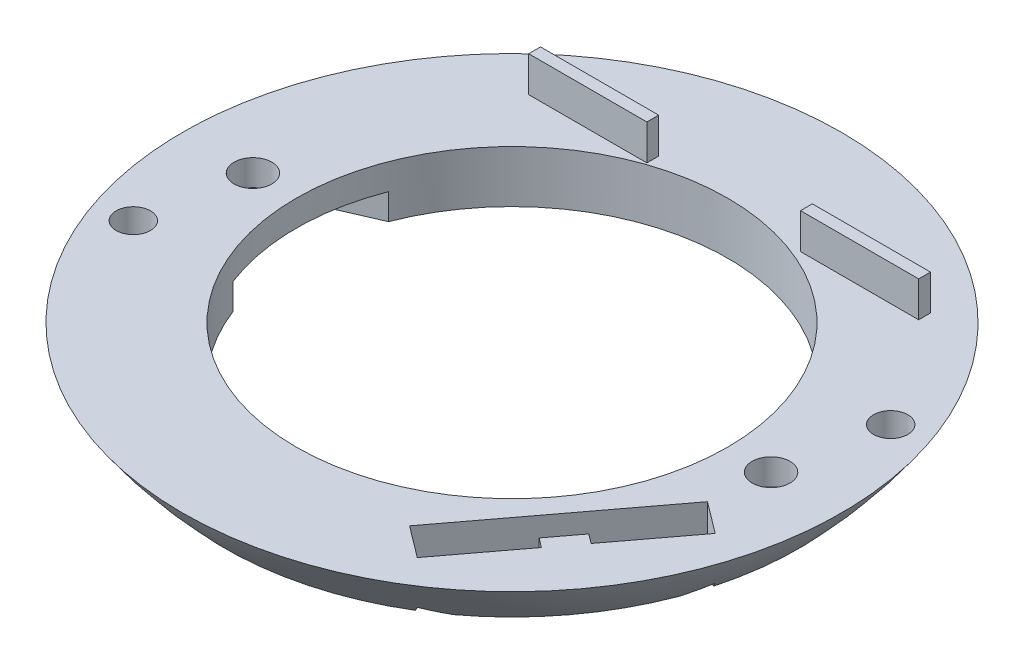
from build123d import *

# Parameters (mm, degrees)
SKETCH2_R                = 33.8
CUT_EXTRUDE1_DEPTH       = 19.1
CUT_EXTRUDE2_START       = -33.8
CUT_EXTRUDE2_DEPTH       = 14.7
BOSS_EXTRUDE2_START      = -2.2
BOSS_EXTRUDE2_DEPTH      = 2.2
CUT_EXTRUDE3_REACH       = 42.08
SKETCH6_R                = 1.6
SKETCH19_R               = 9
CUT_EXTRUDE10_DEPTH      = 1.4
CUT_EXTRUDE11_REACH      = 42.429
CUT_EXTRUDE11_END_RADIUS = 33.8
SKETCH20_R               = 3.5
CUT_EXTRUDE9_REACH       = 44.024
CUT_EXTRUDE9_END_RADIUS  = 33.8
CUT_EXTRUDE7_REACH       = 44.024
CUT_EXTRUDE7_END_RADIUS  = 33.8
SKETCH10_R               = 1.45
SKETCH14_W               = 10
SKETCH14_H               = 1
BOSS_EXTRUDE1_DEPTH      = 3
CUT_EXTRUDE12_START      = -10.118299
SKETCH21_R               = 27.886018002
CUT_EXTRUDE12_DEPTH      = 10.118299


with BuildPart() as part:
    # Sketch1 → Revolve1 (revolve)
    with BuildSketch(Plane.XY, mode=Mode.PRIVATE) as revolve1_sk:
        with BuildLine():
            Line((0, -33.8), (0, 0))
            Line((0, 0), (33.8, 0))
            ThreePointArc((33.8, 0), (23.900209204, -23.900209204), (0, -33.8))
        make_face()
    revolve(revolve1_sk.sketch.rotate(Axis((0, -33.8, 0), (0, 1, 0)), 180), axis=Axis((0, -33.8, 0), (0, 1, 0)))

    # Sketch2 → Cut-Extrude1 (cut)
    with BuildSketch(Plane(origin=(0, 0, 0), x_dir=(1, 0, 0), z_dir=(0, 1, 0))):
        Circle(SKETCH2_R)
    extrude(amount=-CUT_EXTRUDE1_DEPTH, mode=Mode.SUBTRACT)

    # Sketch5 → Cut-Extrude2 (cut)
    with BuildSketch(Plane(origin=(0, 0, 0), x_dir=(1, 0, 0), z_dir=(0, 1, 0)).offset(CUT_EXTRUDE2_START)):
        with BuildLine():
            Line((-17.025732229, 6.571677263), (-23.544283672, 3.742739979))
            ThreePointArc((-23.544283672, 3.742739979), (-23.775794442, 3.633514413), (-24, 3.509985755))
            Line((-24, 3.509985755), (-24, -3.509985755))
            ThreePointArc((-24, -3.509985755), (-23.775794442, -3.633514413), (-23.544283672, -3.742739979))
            Line((-23.544283672, -3.742739979), (-17.025732229, -6.571677263))
            ThreePointArc((-17.025732229, -6.571677263), (0, -18.25), (17.025732229, -6.571677263))
            Line((17.025732229, -6.571677263), (23.544283672, -3.742739979))
            ThreePointArc((23.544283672, -3.742739979), (23.775794442, -3.633514413), (24, -3.509985755))
            Line((24, -3.509985755), (24, 3.509985755))
            ThreePointArc((24, 3.509985755), (23.775794442, 3.633514413), (23.544283672, 3.742739979))
            Line((23.544283672, 3.742739979), (17.025732229, 6.571677263))
            ThreePointArc((17.025732229, 6.571677263), (0, 18.25), (-17.025732229, 6.571677263))
        make_face()
    extrude(amount=CUT_EXTRUDE2_DEPTH, mode=Mode.SUBTRACT)

    # Sketch16 → Boss-Extrude2 (add)
    with BuildSketch(Plane(origin=(0, -19.1, 0), x_dir=(1, 0, 0), z_dir=(0, 1, 0)).offset(BOSS_EXTRUDE2_START)):
        with BuildLine():
            Line((17.025732229, 6.571677263), (23.544283672, 3.742739979))
            ThreePointArc((23.544283672, 3.742739979), (23.775794442, 3.633514413), (24, 3.509985755))
            Line((24, 3.509985755), (24, -3.509985755))
            ThreePointArc((24, -3.509985755), (23.775794442, -3.633514413), (23.544283672, -3.742739979))
            Line((23.544283672, -3.742739979), (17.025732229, -6.571677263))
            ThreePointArc((17.025732229, -6.571677263), (18.25, 0), (17.025732229, 6.571677263))
        make_face()
        with BuildLine():
            Line((-23.544283672, -3.742739979), (-17.025732229, -6.571677263))
            ThreePointArc((-17.025732229, -6.571677263), (-18.25, 0), (-17.025732229, 6.571677263))
            Line((-17.025732229, 6.571677263), (-23.544283672, 3.742739979))
            ThreePointArc((-23.544283672, 3.742739979), (-23.775794442, 3.633514413), (-24, 3.509985755))
            Line((-24, 3.509985755), (-24, -3.509985755))
            ThreePointArc((-24, -3.509985755), (-23.775794442, -3.633514413), (-23.544283672, -3.742739979))
        make_face()
    extrude(amount=BOSS_EXTRUDE2_DEPTH)

    # Sketch6 → Cut-Extrude3 (cut, up to next)
    with BuildSketch(Plane(origin=(0, -21.3, 0), x_dir=(1, 0, 0), z_dir=(0, 1, 0)), mode=Mode.PRIVATE) as cut_extrude3_sk1:
        with Locations(Location((-21.92, 0, 0), (0, 0, 270))):
            Circle(SKETCH6_R)
    cut_extrude3_tool1 = extrude(cut_extrude3_sk1.sketch, amount=CUT_EXTRUDE3_REACH, mode=Mode.PRIVATE) & part.part
    # Sketch6 → Cut-Extrude3 (cut, up to next)
    with BuildSketch(Plane(origin=(0, -21.3, 0), x_dir=(1, 0, 0), z_dir=(0, 1, 0)), mode=Mode.PRIVATE) as cut_extrude3_sk2:
        with Locations(Location((21.92, 0, 0), (0, 0, 270))):
            Circle(SKETCH6_R)
    cut_extrude3_tool2 = extrude(cut_extrude3_sk2.sketch, amount=CUT_EXTRUDE3_REACH, mode=Mode.PRIVATE) & part.part
    add(cut_extrude3_tool1.solids().sort_by_distance((-21.92, -21.3, 0))[0], mode=Mode.SUBTRACT)
    add(cut_extrude3_tool2.solids().sort_by_distance((21.92, -21.3, 0))[0], mode=Mode.SUBTRACT)

    # Revolve2: read off the stored shape, not the designer's step
    # Revolve2 outline → Revolve2 (revolve)
    with BuildSketch(Plane.XY):
        with BuildLine():
            Line((0, -23.5), (0, -33.8))
            ThreePointArc((0, -33.8), (13.168073663, -31.129436808), (24.255308697, -23.53975361))
            Line((24.255308697, -23.53975361), (24.255308697, -23.5))
            Line((24.255308697, -23.5), (0, -23.5))
        make_face()
    revolve(axis=Axis((0, 0, 0), (0, 1, 0)))

    # Sketch19 → Cut-Extrude10 (cut)
    with BuildSketch(Plane(origin=(0, -23.5, 0), x_dir=(1, 0, 0), z_dir=(0, 1, 0))):
        with Locations(Location((0, 0, 0), (0, 0, 180))):
            Circle(SKETCH19_R)
    extrude(amount=-CUT_EXTRUDE10_DEPTH, mode=Mode.SUBTRACT)

    # Cut-Extrude11: up to this sphere (the profile starts inside it)
    cut_extrude11_end = Location((0, 0, 0)) * Sphere(CUT_EXTRUDE11_END_RADIUS, mode=Mode.PRIVATE)
    # Sketch20 → Cut-Extrude11 (cut, up to the surface)
    with BuildSketch(Plane(origin=(0, -24.9, 0), x_dir=(1, 0, 0), z_dir=(0, 1, 0)), mode=Mode.PRIVATE) as cut_extrude11_sk1:
        with Locations(Location((0, 0, 0), (0, 0, 180))):
            Circle(SKETCH20_R)
    cut_extrude11_tool1 = extrude(cut_extrude11_sk1.sketch, amount=-CUT_EXTRUDE11_REACH, mode=Mode.PRIVATE) & cut_extrude11_end
    add(cut_extrude11_tool1.solids().sort_by_distance((0, -24.9, 0))[0], mode=Mode.SUBTRACT)

    # Cut-Extrude9: up to this sphere (the profile starts inside it)
    cut_extrude9_end = Location((0, 0, 0)) * Sphere(CUT_EXTRUDE9_END_RADIUS, mode=Mode.PRIVATE)
    # Sketch13 → Cut-Extrude9 (cut, up to the surface)
    with BuildSketch(Plane(origin=(0, -19.1, 0), x_dir=(1, 0, 0), z_dir=(0, 1, 0)), mode=Mode.PRIVATE) as cut_extrude9_sk1:
        Polygon((10.556374993, -19.224020053), (13.210464636, -21.224020053), (17.724077309, -15.234253728), (16.925441799, -14.632438705), (18.730886869, -12.236532175), (19.529522379, -12.838347198), (24.043135053, -6.848580873), (21.389045409, -4.848580873), align=None)
    cut_extrude9_tool1 = extrude(cut_extrude9_sk1.sketch, amount=-CUT_EXTRUDE9_REACH, mode=Mode.PRIVATE) & cut_extrude9_end
    add(cut_extrude9_tool1.solids().sort_by_distance((17.250772, -19.1, 12.999389))[0], mode=Mode.SUBTRACT)

    # Cut-Extrude7: up to this sphere (the profile starts inside it)
    cut_extrude7_end = Location((0, 0, 0)) * Sphere(CUT_EXTRUDE7_END_RADIUS, mode=Mode.PRIVATE)
    # Sketch10 → Cut-Extrude7 (cut, up to the surface)
    with BuildSketch(Plane(origin=(0, -19.1, 0), x_dir=(1, 0, 0), z_dir=(0, 1, 0)), mode=Mode.PRIVATE) as cut_extrude7_sk1:
        with Locations(Location((-23.49231552, -8.550503583, 0), (0, 0, 270))):
            Circle(SKETCH10_R)
    cut_extrude7_tool1 = extrude(cut_extrude7_sk1.sketch, amount=-CUT_EXTRUDE7_REACH, mode=Mode.PRIVATE) & cut_extrude7_end
    add(cut_extrude7_tool1.solids().sort_by_distance((-23.492316, -19.1, 8.550504))[0], mode=Mode.SUBTRACT)
    # Sketch10 → Cut-Extrude7 (cut, up to the surface)
    with BuildSketch(Plane(origin=(0, -19.1, 0), x_dir=(1, 0, 0), z_dir=(0, 1, 0)), mode=Mode.PRIVATE) as cut_extrude7_sk2:
        with Locations(Location((23.49231552, 8.550503583, 0), (0, 0, 270))):
            Circle(SKETCH10_R)
    cut_extrude7_tool2 = extrude(cut_extrude7_sk2.sketch, amount=-CUT_EXTRUDE7_REACH, mode=Mode.PRIVATE) & cut_extrude7_end
    add(cut_extrude7_tool2.solids().sort_by_distance((23.492316, -19.1, -8.550504))[0], mode=Mode.SUBTRACT)

    # Sketch14 → Boss-Extrude1 (add)
    with BuildSketch(Plane(origin=(0, -19.1, 0), x_dir=(1, 0, 0), z_dir=(0, 1, 0))):
        with Locations((12, 17.911516357)):
            Rectangle(SKETCH14_W, SKETCH14_H)
        with Locations((-11, 17.911516357)):
            Rectangle(SKETCH14_W, SKETCH14_H)
    extrude(amount=BOSS_EXTRUDE1_DEPTH)

    # Sketch21 → Cut-Extrude12 (cut)
    with BuildSketch(Plane(origin=(0, -23.5, 0), x_dir=(1, 0, 0), z_dir=(0, 1, 0)).offset(CUT_EXTRUDE12_START)):
        Circle(SKETCH21_R)
    extrude(amount=CUT_EXTRUDE12_DEPTH, mode=Mode.SUBTRACT)


solid = part.part
